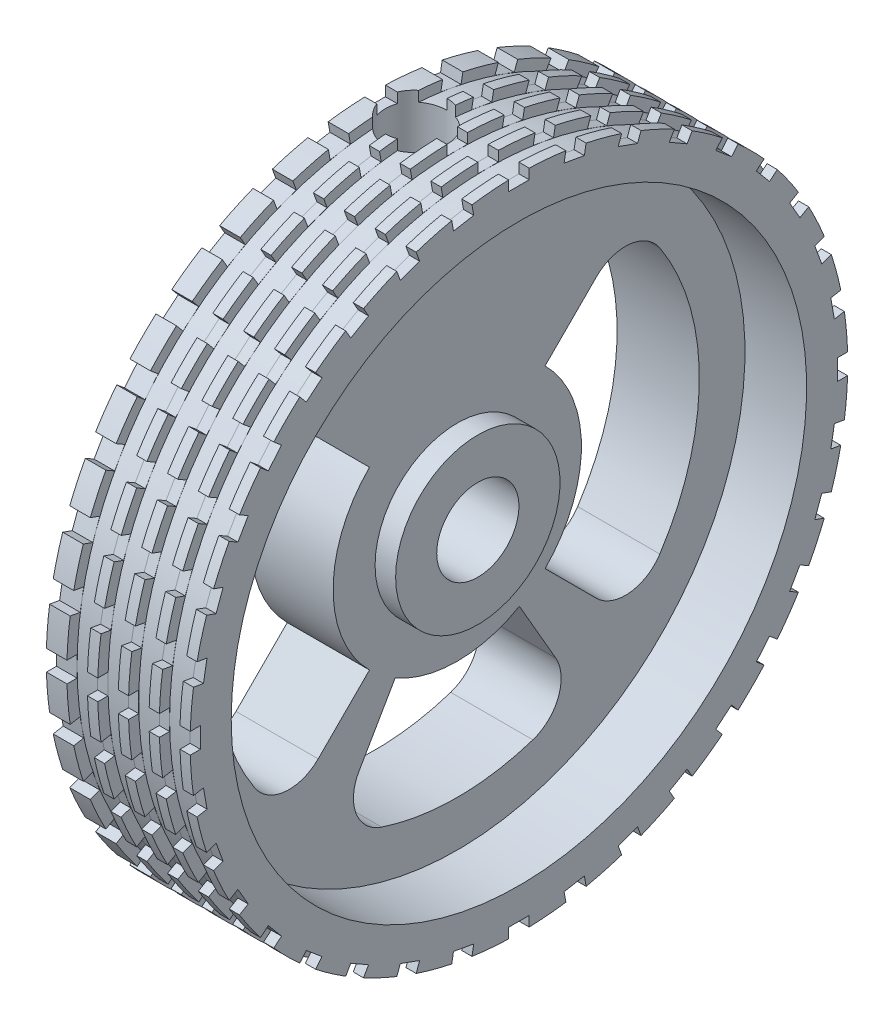
from build123d import *

# Parameters (mm, degrees)
CUT_EXTRUDE4_DEPTH = 24.685438729
SKETCH6_W          = 1
SKETCH6_H          = 0.5
CUT_EXTRUDE5_START = 15.5
SKETCH7_W          = 7
SKETCH7_H          = 1
CUT_EXTRUDE5_DEPTH = 20
CIRPATTERN1_COUNT  = 36
LPATTERN1_COUNT    = 4
LPATTERN1_PITCH    = 1.5
FILLET1_R          = 2
FILLET2_R          = 2
FILLET3_R          = 2
FILLET4_R          = 2
FILLET5_R          = 2
FILLET6_R          = 2


with BuildPart() as part:
    # Sketch1 → Revolve1 (revolve)
    with BuildSketch(Plane.XY):
        Polygon((0, 2), (5, 2), (5, 4), (4, 4), (4, 14), (7, 14), (7, 16), (0, 16), align=None)
    revolve(axis=Axis((0, 0, 0), (1, 0, 0)))

    # Sketch3 → Cut-Revolve1 (revolve, cut)
    with BuildSketch(Plane.XY):
        Polygon((2, 0), (2, 16), (3.5, 16), (3.5, 11.5), (2.9, 11.5), (2.9, 0), align=None)
    revolve(axis=Axis((2, 0, 0), (0, 1, 0)), mode=Mode.SUBTRACT)

    # Sketch4 → Cut-Extrude4 (cut, through all)
    with BuildSketch(Plane(origin=(0, 0, 0), x_dir=(0, 0, -1), z_dir=(1, 0, 0))):
        with BuildLine():
            ThreePointArc((-4.27216773, -4.27216773), (-6.041757545, 0), (-4.27216773, 4.27216773))
            Line((-4.27216773, 4.27216773), (-8.328853833, 8.328853833))
            ThreePointArc((-8.328853833, 8.328853833), (-11.778778049, 0), (-8.328853833, -8.328853833))
            Line((-8.328853833, -8.328853833), (-4.27216773, -4.27216773))
        make_face()
        with BuildLine():
            Line((8.328853833, 8.328853833), (4.27216773, 4.27216773))
            ThreePointArc((4.27216773, 4.27216773), (6.041757545, 0), (4.27216773, -4.27216773))
            Line((4.27216773, -4.27216773), (8.328853833, -8.328853833))
            ThreePointArc((8.328853833, -8.328853833), (11.778778049, 0), (8.328853833, 8.328853833))
        make_face()
        with BuildLine():
            ThreePointArc((3.020878773, -5.232315518), (0, -6.041757545), (-3.020878773, -5.232315518))
            Line((-3.020878773, -5.232315518), (-5.889389025, -10.200721016))
            ThreePointArc((-5.889389025, -10.200721016), (0, -11.778778049), (5.889389025, -10.200721016))
            Line((5.889389025, -10.200721016), (3.020878773, -5.232315518))
        make_face()
    extrude(amount=CUT_EXTRUDE4_DEPTH, mode=Mode.SUBTRACT)

    # Sketch6 → Cut-Revolve2 (revolve, cut)
    with BuildSketch(Plane(origin=(0, 0, 0), x_dir=(1, 0, 0), z_dir=(0, 1, 0))):
        with Locations((6, 15.75)):
            Rectangle(SKETCH6_W, SKETCH6_H)
    cut_revolve2 = revolve(axis=Axis((0, 0, 0), (1, 0, 0)), mode=Mode.SUBTRACT)

    # Sketch7 → Cut-Extrude5 (cut)
    with BuildSketch(Plane(origin=(0, 0, 0), x_dir=(1, 0, 0), z_dir=(0, 1, 0)).offset(CUT_EXTRUDE5_START)):
        with Locations((3.5, 0)):
            Rectangle(SKETCH7_W, SKETCH7_H)
    cut_extrude5 = extrude(amount=CUT_EXTRUDE5_DEPTH, mode=Mode.SUBTRACT)

    # CirPattern1: Cut-Extrude5 ×36 about axis
    cirpattern1_axis = Axis((0, 0, 0), (-1, 0, 0))
    for i in range(1, CIRPATTERN1_COUNT):
        add(cut_extrude5.rotate(cirpattern1_axis, i * 360 / CIRPATTERN1_COUNT), mode=Mode.SUBTRACT)

    # LPattern1: Cut-Revolve2 ×4
    with Locations(*[(-i * LPATTERN1_PITCH, 0, 0) for i in range(1, LPATTERN1_COUNT)]):
        add(cut_revolve2, mode=Mode.SUBTRACT)

    # Fillet1
    fillet1_edges = [part.edges().sort_by_distance(p)[0] for p in [
        (2, 8.328853833, 8.328853833),
    ]]
    fillet(fillet1_edges, radius=FILLET1_R)

    # Fillet2
    fillet2_edges = [part.edges().sort_by_distance(p)[0] for p in [
        (2, -8.328853833, 8.328853833),
    ]]
    fillet(fillet2_edges, radius=FILLET2_R)

    # Fillet3
    fillet3_edges = [part.edges().sort_by_distance(p)[0] for p in [
        (2, -10.200721016, 5.889389025),
    ]]
    fillet(fillet3_edges, radius=FILLET3_R)

    # Fillet4
    fillet4_edges = [part.edges().sort_by_distance(p)[0] for p in [
        (2, -10.200721016, -5.889389025),
    ]]
    fillet(fillet4_edges, radius=FILLET4_R)

    # Fillet5
    fillet5_edges = [part.edges().sort_by_distance(p)[0] for p in [
        (2, -8.328853833, -8.328853833),
    ]]
    fillet(fillet5_edges, radius=FILLET5_R)

    # Fillet6
    fillet6_edges = [part.edges().sort_by_distance(p)[0] for p in [
        (2, 8.328853833, -8.328853833),
    ]]
    fillet(fillet6_edges, radius=FILLET6_R)


solid = part.part
